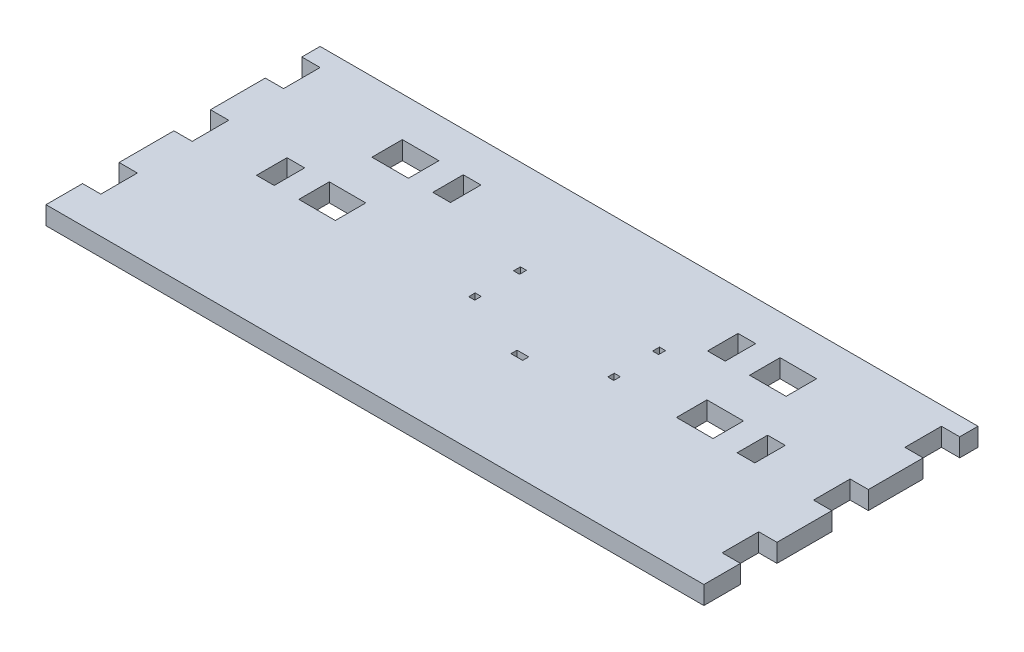
from build123d import *

# Parameters (mm, degrees)
SKETCH1_W          = 2.9
SKETCH1_H          = 5
SKETCH1_W_2        = 6
BASE_FLANGE1_DEPTH = 3
SKETCH25_W         = 9
SKETCH25_H         = 9.641148945
SKETCH25_W_2       = 7.205840792
CUT_EXTRUDE2_DEPTH = 10
SKETCH31_W         = 3
SKETCH31_H         = 6
CUT_EXTRUDE3_DEPTH = 10
SKETCH32_W         = 1
SKETCH32_H         = 1.138346555
SKETCH32_H_2       = 1.067484408
SKETCH32_W_2       = 1.923552289
SKETCH32_H_3       = 1
CUT_EXTRUDE4_DEPTH = 10


# Sheet-metal steps are written as plain solids
with BuildPart() as part:
    # Sketch1 → Base-Flange1 (new body)
    with BuildSketch(Plane(origin=(0, 0, 0), x_dir=(1, 0, 0), z_dir=(0, 1, 0))):
        Polygon((-80, 31.946571622), (-80, -13.053428378), (80, -13.053428378), (80, 31.946571622), (80, 41.587720567), (45, 41.587720567), (45, 31.946571622), (-45, 31.946571622), (-45, 41.587720567), (-80, 41.587720567), align=None)
        with Locations((-39.45, 10.905641405)):
            Rectangle(SKETCH1_W, SKETCH1_H, mode=Mode.SUBTRACT)
        with Locations((-22.55, 22.947848405)):
            Rectangle(SKETCH1_W, SKETCH1_H, mode=Mode.SUBTRACT)
        with Locations((-31, 22.946571622)):
            Rectangle(SKETCH1_W_2, SKETCH1_H, mode=Mode.SUBTRACT)
        with Locations((-31, 10.946571622)):
            Rectangle(SKETCH1_W_2, SKETCH1_H, mode=Mode.SUBTRACT)
        with Locations((31, 10.946571622)):
            Rectangle(SKETCH1_W_2, SKETCH1_H, mode=Mode.SUBTRACT)
        with Locations((31, 22.946571622)):
            Rectangle(SKETCH1_W_2, SKETCH1_H, mode=Mode.SUBTRACT)
        with Locations((22.55, 22.947848405)):
            Rectangle(SKETCH1_W, SKETCH1_H, mode=Mode.SUBTRACT)
        with Locations((39.45, 10.905641405)):
            Rectangle(SKETCH1_W, SKETCH1_H, mode=Mode.SUBTRACT)
    extrude(amount=-BASE_FLANGE1_DEPTH)

    # Sketch25 → Cut-Extrude2 (cut)
    with BuildSketch(Plane.XZ.offset(3)):
        Polygon((80, 13.053428378), (54, 13.053428378), (54, -31.946571622), (61.205840792, -31.946571622), (61.205840792, -41.587720567), (80, -41.587720567), align=None)
        with Locations((49.5, -36.767146095)):
            Rectangle(SKETCH25_W, SKETCH25_H)
        with Locations((57.602920396, -36.767146095)):
            Rectangle(SKETCH25_W_2, SKETCH25_H)
        with Locations((-49.5, -36.767146095)):
            Rectangle(SKETCH25_W, SKETCH25_H)
        with Locations((-57.602920396, -36.767146095)):
            Rectangle(SKETCH25_W_2, SKETCH25_H)
        Polygon((-54, -31.946571622), (-54, 13.053428378), (-80, 13.053428378), (-80, -41.587720567), (-61.205840792, -41.587720567), (-61.205840792, -31.946571622), align=None)
    extrude(amount=-CUT_EXTRUDE2_DEPTH, mode=Mode.SUBTRACT)

    # Sketch31 → Cut-Extrude3 (cut)
    with BuildSketch(Plane(origin=(0, 0, 0), x_dir=(1, 0, 0), z_dir=(0, 1, 0))):
        with Locations((52.5, 25.946571622)):
            Rectangle(SKETCH31_W, SKETCH31_H)
        with Locations((52.5, 10.946571622)):
            Rectangle(SKETCH31_W, SKETCH31_H)
        with Locations((52.5, -4.053428378)):
            Rectangle(SKETCH31_W, SKETCH31_H)
        with Locations((-52.5, 25.946571622)):
            Rectangle(SKETCH31_W, SKETCH31_H)
        with Locations((-52.5, 10.946571622)):
            Rectangle(SKETCH31_W, SKETCH31_H)
        with Locations((-52.5, -4.053428378)):
            Rectangle(SKETCH31_W, SKETCH31_H)
    extrude(amount=-CUT_EXTRUDE3_DEPTH, mode=Mode.SUBTRACT)

    # Sketch32 → Cut-Extrude4 (cut)
    with BuildSketch(Plane(origin=(0, 0, 0), x_dir=(1, 0, 0), z_dir=(0, 1, 0))):
        with Locations((-5.726537828, 16.486113061)):
            Rectangle(SKETCH32_W, SKETCH32_H)
        with Locations((-5.726537828, 9.095449689)):
            Rectangle(SKETCH32_W, SKETCH32_H_2)
        with Locations((17.1, 16.486113061)):
            Rectangle(SKETCH32_W, SKETCH32_H)
        with Locations((17.1, 9.095449689)):
            Rectangle(SKETCH32_W, SKETCH32_H_2)
        with Locations((6.311776145, 4.428231045)):
            Rectangle(SKETCH32_W_2, SKETCH32_H_3)
    extrude(amount=-CUT_EXTRUDE4_DEPTH, mode=Mode.SUBTRACT)


solid = part.part
